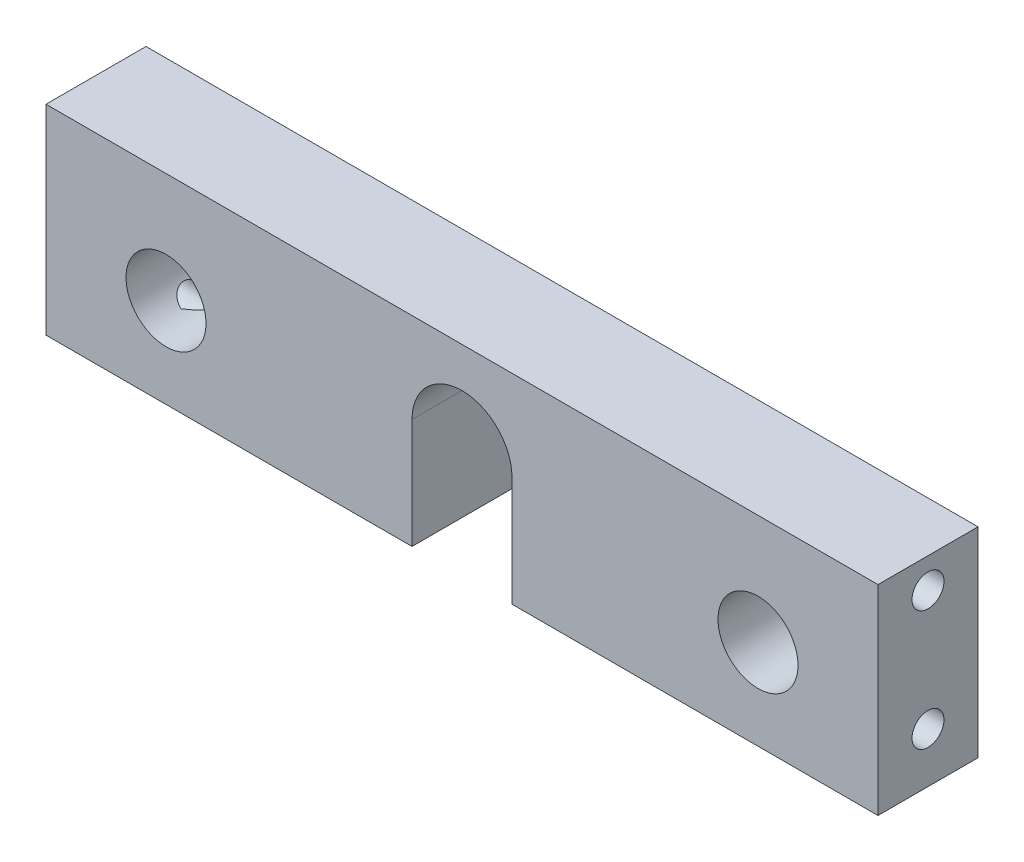
from build123d import *

# Parameters (mm, degrees)
SKETCH1_W                       = 5
SKETCH1_H                       = 10
BOSS_EXTRUDE1_DEPTH             = 41.6
TAP_DRILL_FOR_M2X0_4_TAP1_D     = 1.6
TAP_DRILL_FOR_M2X0_4_TAP1_DEPTH = 5
TAP_DRILL_FOR_M2X0_4_TAP1_TIP   = 0.480688495
TAP_DRILL_FOR_M2X0_4_TAP2_D     = 1.6
TAP_DRILL_FOR_M2X0_4_TAP2_DEPTH = 5
TAP_DRILL_FOR_M2X0_4_TAP2_TIP   = 0.480688495
CUT_EXTRUDE1_REACH              = 45.076
SKETCH8_R                       = 2


with BuildPart() as part:
    # Sketch1 → Boss-Extrude1 (new body)
    with BuildSketch(Plane(origin=(0, 0, 0), x_dir=(0, 0, -1), z_dir=(1, 0, 0))):
        with Locations((0, 5)):
            Rectangle(SKETCH1_W, SKETCH1_H)
    extrude(amount=BOSS_EXTRUDE1_DEPTH)

    # Tap Drill for M2x0.4 Tap1
    with Locations(Plane(origin=(41.6, 0, 0), x_dir=(0, 0, -1), z_dir=(1, 0, 0))):
        with Locations((0, 8.5), (0, 2.5)):
            Hole(TAP_DRILL_FOR_M2X0_4_TAP1_D / 2, depth=TAP_DRILL_FOR_M2X0_4_TAP1_DEPTH)
            with Locations((0, 0, -(TAP_DRILL_FOR_M2X0_4_TAP1_DEPTH + TAP_DRILL_FOR_M2X0_4_TAP1_TIP / 2))):  # 118° drill point
                Cone(0, TAP_DRILL_FOR_M2X0_4_TAP1_D / 2, TAP_DRILL_FOR_M2X0_4_TAP1_TIP, mode=Mode.SUBTRACT)

    # Tap Drill for M2x0.4 Tap2
    with Locations(Plane.ZY):
        with Locations((0, 8.5), (0, 2.5)):
            Hole(TAP_DRILL_FOR_M2X0_4_TAP2_D / 2, depth=TAP_DRILL_FOR_M2X0_4_TAP2_DEPTH)
            with Locations((0, 0, -(TAP_DRILL_FOR_M2X0_4_TAP2_DEPTH + TAP_DRILL_FOR_M2X0_4_TAP2_TIP / 2))):  # 118° drill point
                Cone(0, TAP_DRILL_FOR_M2X0_4_TAP2_D / 2, TAP_DRILL_FOR_M2X0_4_TAP2_TIP, mode=Mode.SUBTRACT)

    # Sketch8 → Cut-Extrude1 (cut, up to next)
    with BuildSketch(Plane.XY.offset(2.5), mode=Mode.PRIVATE) as cut_extrude1_sk1:
        with Locations((6, 4.5)):
            Circle(SKETCH8_R)
    cut_extrude1_tool1 = extrude(cut_extrude1_sk1.sketch, amount=-CUT_EXTRUDE1_REACH, mode=Mode.PRIVATE) & part.part
    # Sketch8 → Cut-Extrude1 (cut, up to next)
    with BuildSketch(Plane.XY.offset(2.5), mode=Mode.PRIVATE) as cut_extrude1_sk2:
        with Locations((35.6, 4.5)):
            Circle(SKETCH8_R)
    cut_extrude1_tool2 = extrude(cut_extrude1_sk2.sketch, amount=-CUT_EXTRUDE1_REACH, mode=Mode.PRIVATE) & part.part
    # Sketch8 → Cut-Extrude1 (cut, up to next)
    with BuildSketch(Plane.XY.offset(2.5), mode=Mode.PRIVATE) as cut_extrude1_sk3:
        with BuildLine():
            Line((18.3, 0), (18.3, 5.5))
            ThreePointArc((18.3, 5.5), (20.8, 8), (23.3, 5.5))
            Line((23.3, 5.5), (23.3, 0))
            Line((23.3, 0), (18.3, 0))
        make_face()
    cut_extrude1_tool3 = extrude(cut_extrude1_sk3.sketch, amount=-CUT_EXTRUDE1_REACH, mode=Mode.PRIVATE) & part.part
    add(cut_extrude1_tool1.solids().sort_by_distance((6, 4.5, 2.5))[0], mode=Mode.SUBTRACT)
    add(cut_extrude1_tool2.solids().sort_by_distance((35.6, 4.5, 2.5))[0], mode=Mode.SUBTRACT)
    add(cut_extrude1_tool3.solids().sort_by_distance((20.8, 3.752606, 2.5))[0], mode=Mode.SUBTRACT)


solid = part.part
